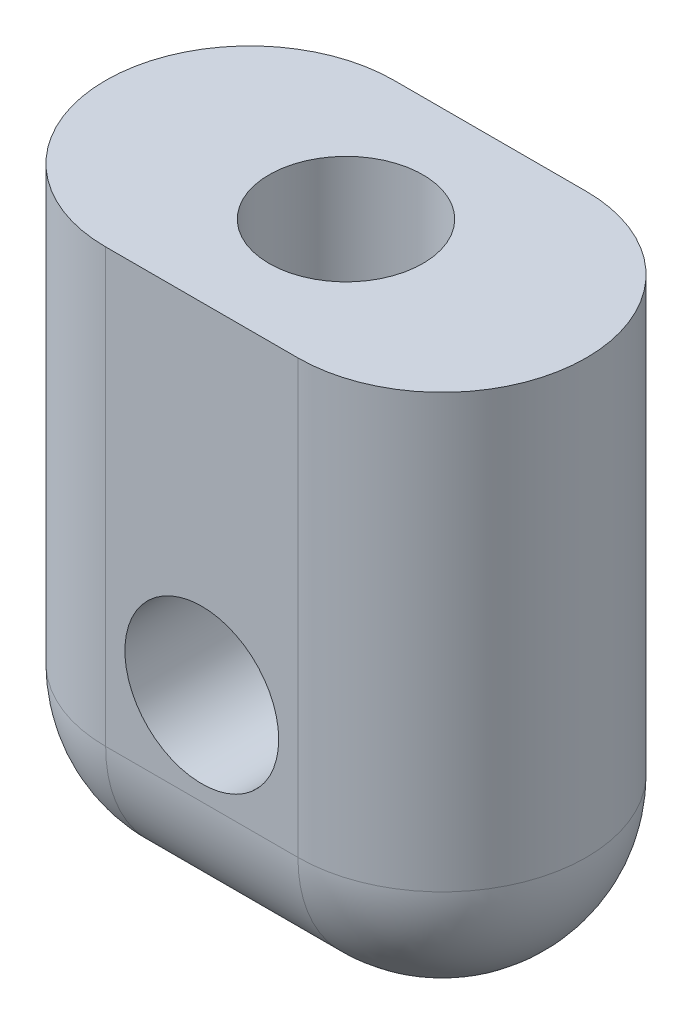
from build123d import *

# Parameters (mm, degrees)
BOSS_EXTRUDE1_DEPTH = 12
FILLET3_R           = 3
SKETCH2_R           = 1.6
CUT_EXTRUDE1_DEPTH  = 20
SKETCH4_R           = 1.6
CUT_EXTRUDE2_DEPTH  = 4


with BuildPart() as part:
    # Sketch1 → Boss-Extrude1 (new body)
    with BuildSketch(Plane(origin=(0, 0, 0), x_dir=(1, 0, 0), z_dir=(0, 1, 0))):
        with BuildLine():
            Line((0, 3), (4, 3))
            ThreePointArc((4, 3), (7, 0), (4, -3))
            Line((4, -3), (0, -3))
            ThreePointArc((0, -3), (-3, 0), (0, 3))
        make_face()
    extrude(amount=BOSS_EXTRUDE1_DEPTH)

    # Fillet3
    fillet3_edges = [part.edges().sort_by_distance(p)[0] for p in [
        (2, 0, -3),
        (7, 0, 0),
        (2, 0, 3),
        (-3, 0, 0),
    ]]
    fillet(fillet3_edges, radius=FILLET3_R - 0.0001)  # a hair under: the kernel refuses the full size

    # Sketch2 → Cut-Extrude1 (cut)
    with BuildSketch(Plane.XY.offset(3)):
        with Locations((2, 4.925974627)):
            Circle(SKETCH2_R)
    extrude(amount=-CUT_EXTRUDE1_DEPTH, mode=Mode.SUBTRACT)

    # Sketch4 → Cut-Extrude2 (cut)
    with BuildSketch(Plane(origin=(0, 12, 0), x_dir=(1, 0, 0), z_dir=(0, 1, 0))):
        with Locations(Location((2, 0, 0), (0, 0, 270))):
            Circle(SKETCH4_R)
    extrude(amount=-CUT_EXTRUDE2_DEPTH, mode=Mode.SUBTRACT)


solid = part.part
